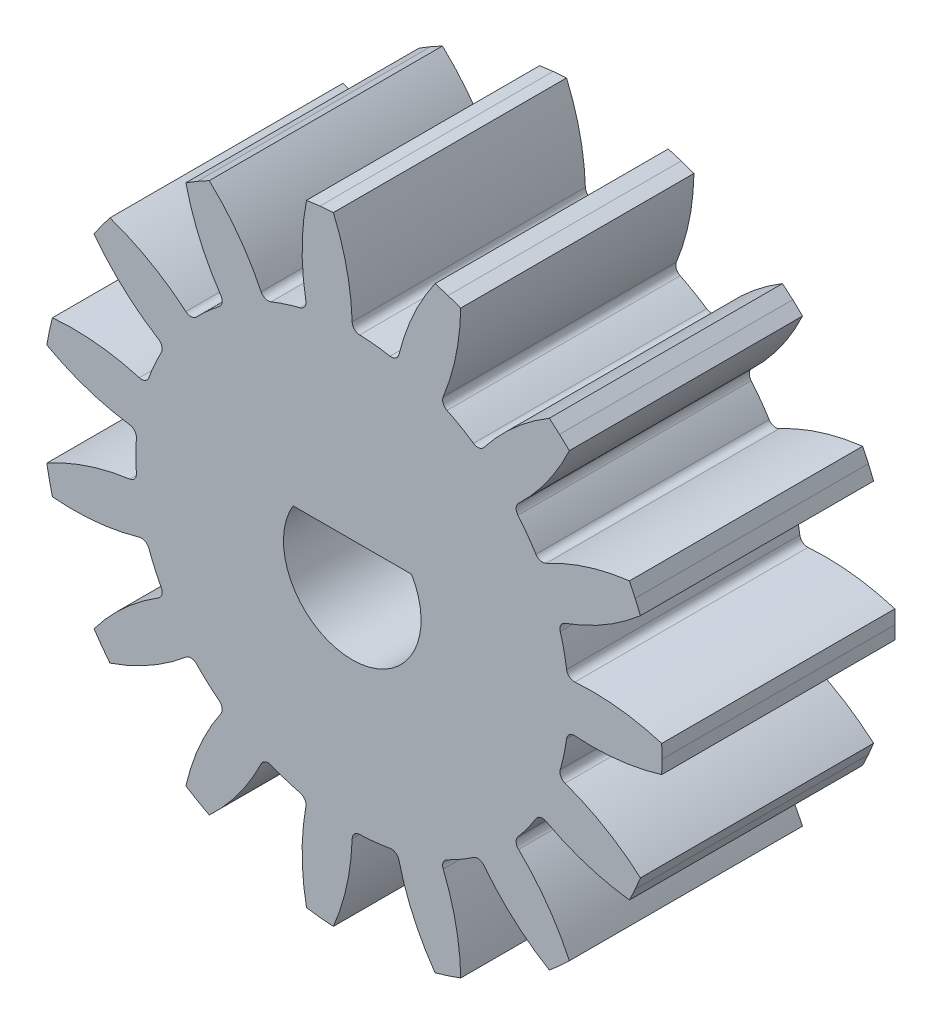
from build123d import *

# Parameters (mm, degrees)
BOSS_EXTRUDE1_DEPTH      = 10
FILLET1_R                = 0.3325
CIRPATTERN1_COUNT        = 15
FILLET1_OF_CIRPATTERN1_R = 0.3325
CUT_EXTRUDE1_START       = -10
CUT_EXTRUDE1_DEPTH       = 10


# Read off the part's stored shape, not the designer's step: Cut-Extrude1
with BuildPart() as part:
    # Sketch1 → Boss-Extrude1 (new body)
    with BuildSketch(Plane.XY):
        with BuildLine():
            Line((13.268609193, 0.579319988), (13.28125, 0))
            Line((13.28125, 0), (13.268609193, -0.579319988))
            ThreePointArc((13.268609193, -0.579319988), (11.2692337, -0.978550661), (9.230406341, -0.9701548))
            ThreePointArc((9.230406341, -0.9701548), (9.166982411, -1.451907379), (9.078432419, -1.92968038))
            Line((9.078432419, -1.92968038), (0, 0))
            Line((0, 0), (9.078432419, 1.92968038))
            ThreePointArc((9.078432419, 1.92968038), (9.166982411, 1.451907379), (9.230406341, 0.9701548))
            ThreePointArc((9.230406341, 0.9701548), (11.2692337, 0.978550661), (13.268609193, 0.579319988))
        make_face()
    boss_extrude1 = extrude(amount=BOSS_EXTRUDE1_DEPTH)

    # Fillet1
    fillet1_edges = [part.edges().sort_by_distance(p)[0] for p in [
        (9.230406341, 0.9701548, 5),
        (9.230406341, -0.9701548, 5),
    ]]
    fillet(fillet1_edges, radius=FILLET1_R)

    # CirPattern1: Boss-Extrude1 ×15 about axis
    cirpattern1_axis = Axis((0, 0, 0), (0, 0, 1))
    for i in range(1, CIRPATTERN1_COUNT):
        add(boss_extrude1.rotate(cirpattern1_axis, i * 360 / CIRPATTERN1_COUNT))

    # Fillet1 of CirPattern1
    fillet1_of_cirpattern1_edges = [part.edges().sort_by_distance(p)[0] for p in [
        (8.037798279, 4.640625, 5),
        (8.826993292, 2.868063979, 5),
        (5.455381873, 7.508688979, 5),
        (6.897312911, 6.21036844, 5),
        (1.92968038, 9.078432419, 5),
        (3.775024469, 8.478843779, 5),
        (-1.92968038, 9.078432419, 5),
        (0, 9.28125, 5),
        (-5.455381873, 7.508688979, 5),
        (-3.775024469, 8.478843779, 5),
        (-8.037798279, 4.640625, 5),
        (-6.897312911, 6.21036844, 5),
        (-9.230406341, 0.9701548, 5),
        (-8.826993292, 2.868063979, 5),
        (-8.826993292, -2.868063979, 5),
        (-9.230406341, -0.9701548, 5),
        (-6.897312911, -6.21036844, 5),
        (-8.037798279, -4.640625, 5),
        (-3.775024469, -8.478843779, 5),
        (-5.455381873, -7.508688979, 5),
        (0, -9.28125, 5),
        (-1.92968038, -9.078432419, 5),
        (3.775024469, -8.478843779, 5),
        (1.92968038, -9.078432419, 5),
        (6.897312911, -6.21036844, 5),
        (5.455381873, -7.508688979, 5),
        (8.826993292, -2.868063979, 5),
        (8.037798279, -4.640625, 5),
    ]]
    fillet(fillet1_of_cirpattern1_edges, radius=FILLET1_OF_CIRPATTERN1_R)

    # Cut-Extrude1 outline → Cut-Extrude1 (cut)
    with BuildSketch(Plane(origin=(0, 0, 0), x_dir=(-1, 0, 0), z_dir=(0, 0, -1)).offset(CUT_EXTRUDE1_START)):
        with BuildLine():
            Line((2.540177159, 1.5), (-2.540177159, 1.5))
            ThreePointArc((-2.540177159, 1.5), (0, -2.95), (2.540177159, 1.5))
        make_face()
    extrude(amount=CUT_EXTRUDE1_DEPTH, mode=Mode.SUBTRACT)


solid = part.part
